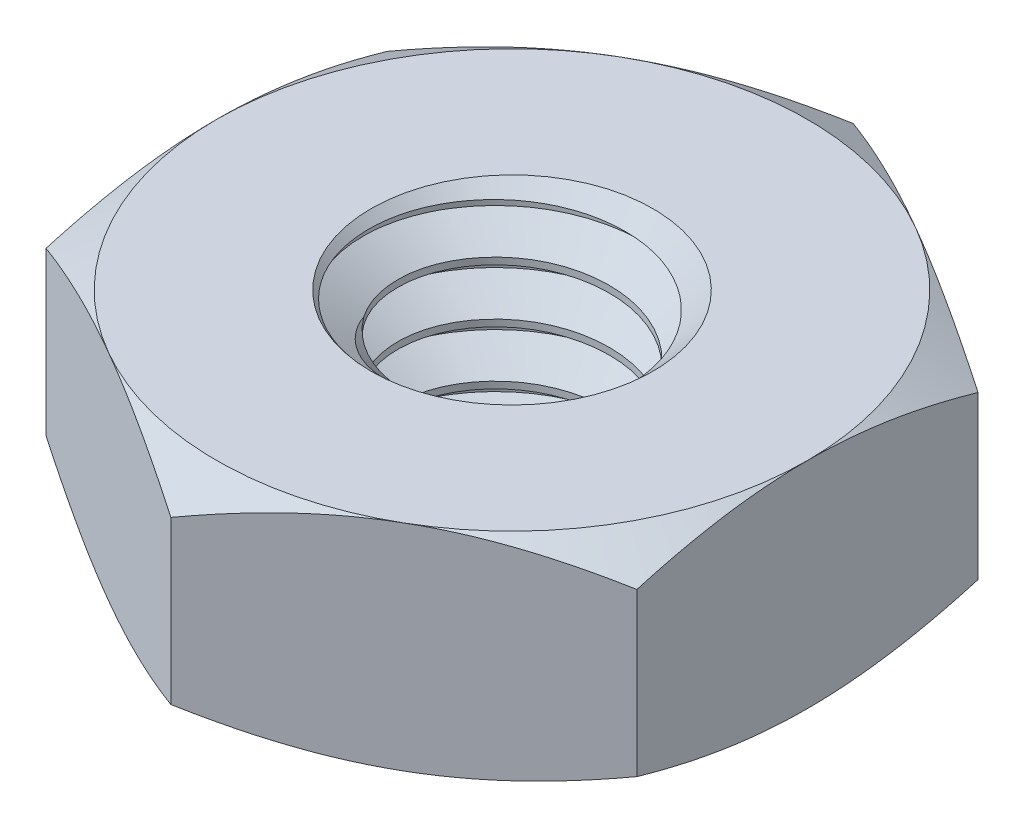
from build123d import *

# Parameters (mm, degrees)
SKETCH11_R              = 2.0828
BOSS_EXTRUDE1_DEPTH     = 1.5875
SKETCH5_OUTSIDE_W       = 42.524
SKETCH5_OUTSIDE_H       = 43.874
SKETCH5_OUTSIDE_R       = 4.365625
CUT_EXTRUDE1_DEPTH      = 8.385856901
CUT_EXTRUDE1_DRAFT      = -60
MIRROR1_COPY_1_SKETCH_W = 42.524
MIRROR1_COPY_1_SKETCH_H = 43.874
MIRROR1_COPY_1_SKETCH_R = 4.365625
MIRROR1_COPY_1_DEPTH    = 8.385856901
MIRROR1_COPY_1_DRAFT    = -60
SKETCH23_R              = 2.0828
BOSS_EXTRUDE2_DEPTH     = 3.175
BOSS_EXTRUDE3_START     = -3.175
SKETCH24_R              = 2.0828
BOSS_EXTRUDE3_DEPTH     = 3.175
CUT_SWEEP1_PITCH        = 0.79375


with BuildPart() as part:
    # Sketch11 → Boss-Extrude1 (new, symmetric)
    with BuildSketch(Plane(origin=(0, 0, 0), x_dir=(1, 0, 0), z_dir=(0, 1, 0))):
        Polygon((-4.365625, 2.520494769), (-4.365625, -2.520494769), (0, -5.040989538), (4.365625, -2.520494769), (4.365625, 2.520494769), (0, 5.040989538), align=None)
        with Locations(Location((0, 0, 0), (0, 0, 270))):
            Circle(SKETCH11_R, mode=Mode.SUBTRACT)
    extrude(amount=BOSS_EXTRUDE1_DEPTH, both=True)


with BuildPart() as cut_extrude1_tool:
    # Sketch5 outside → Cut-Extrude1 (with draft: the straight prism first)
    with BuildSketch(Plane(origin=(0, 1.5875, 0), x_dir=(1, 0, 0), z_dir=(0, 1, 0))):
        Rectangle(SKETCH5_OUTSIDE_W, SKETCH5_OUTSIDE_H)
        Circle(SKETCH5_OUTSIDE_R, mode=Mode.SUBTRACT)
    extrude(amount=-CUT_EXTRUDE1_DEPTH)
    # Cut-Extrude1: the draft: its side faces are tilted about the plane it starts from
    cut_extrude1_sides = [cut_extrude1_tool.faces().sort_by_distance(p)[0] for p in [
        (0, -2.60542845, 21.937),
        (21.262, -2.60542845, 0),
        (0, -2.60542845, -21.937),
        (-21.262, -2.60542845, 0),
        (-4.365625, -2.60542845, 0),
    ]]
    draft(cut_extrude1_sides, Plane(origin=(0, 1.5875, 0), x_dir=(1, 0, 0), z_dir=(0, 1, 0)), CUT_EXTRUDE1_DRAFT)


with BuildPart() as part_1:
    add(part.part)

    # Cut-Extrude1: cut by cut_extrude1_tool
    add(cut_extrude1_tool.part, mode=Mode.SUBTRACT)


with BuildPart() as mirror1_copy_1_tool:
    # Mirror1 copy 1 sketch → Mirror1 copy 1 (with draft: the straight prism first)
    with BuildSketch(Plane.XZ.offset(1.5875)):
        Rectangle(MIRROR1_COPY_1_SKETCH_W, MIRROR1_COPY_1_SKETCH_H)
        Circle(MIRROR1_COPY_1_SKETCH_R, mode=Mode.SUBTRACT)
    extrude(amount=-MIRROR1_COPY_1_DEPTH)
    # Mirror1 copy 1: the draft: its side faces are tilted about the plane it starts from
    mirror1_copy_1_sides = [mirror1_copy_1_tool.faces().sort_by_distance(p)[0] for p in [
        (0, 2.60542845, 21.937),
        (21.262, 2.60542845, 0),
        (0, 2.60542845, -21.937),
        (-21.262, 2.60542845, 0),
        (-4.365625, 2.60542845, 0),
    ]]
    draft(mirror1_copy_1_sides, Plane.XZ.offset(1.5875), MIRROR1_COPY_1_DRAFT)


with BuildPart() as part_2:
    add(part_1.part)

    # Mirror1 copy 1: cut by mirror1_copy_1_tool
    add(mirror1_copy_1_tool.part, mode=Mode.SUBTRACT)

    # Sketch24 → Boss-Extrude3 (add)
    with BuildSketch(Plane(origin=(0, 1.5875, 0), x_dir=(1, 0, 0), z_dir=(0, 1, 0)).offset(BOSS_EXTRUDE3_START)):
        with Locations(Location((0, 0, 0), (0, 0, 270))):
            Circle(SKETCH24_R)
    extrude(amount=BOSS_EXTRUDE3_DEPTH)


with BuildPart() as body_2:
    # Sketch23 → Boss-Extrude2 (new body)
    with BuildSketch(Plane(origin=(0, 1.5875, 0), x_dir=(1, 0, 0), z_dir=(0, 1, 0))):
        with Locations(Location((0, 0, 0), (0, 0, 270))):
            Circle(SKETCH23_R)
    extrude(amount=-BOSS_EXTRUDE2_DEPTH)

    # Cut-Sweep1: the profile of Sketch25 profile screwed along a right-hand helix of 5 turns, 8 arcs to a turn; built about Z, then put on its axis
    cut_sweep1_z = Axis((0, 0, 0), (0, 0, 1))
    cut_sweep1_corners = [(2.0831, 0, 0.000173205), (2.0831, 0, -0.694704455), (1.567244252, 0, -0.396875), (1.567244252, 0, -0.29765625)]
    with BuildLine(mode=Mode.PRIVATE) as cut_sweep1_profile:
        Line(cut_sweep1_corners[0], cut_sweep1_corners[1])
        Line(cut_sweep1_corners[1], cut_sweep1_corners[2])
        Line(cut_sweep1_corners[2], cut_sweep1_corners[3])
        Line(cut_sweep1_corners[3], cut_sweep1_corners[0])
    cut_sweep1_cap = Face(cut_sweep1_profile.wire())
    cut_sweep1_turn_angles = [0, 22.5, 45, 67.5, 90, 112.5, 135, 157.5, 180, 202.5, 225, 247.5, 270, 292.5, 315, 337.5, 360]
    cut_sweep1_turn_weights = [1, 0.9238795325112867, 1, 0.9238795325112867, 1, 0.9238795325112867, 1, 0.9238795325112867, 1, 0.9238795325112867, 1, 0.9238795325112867, 1, 0.9238795325112867, 1, 0.9238795325112867, 1]
    cut_sweep1_turn_rails = [Edge.make_bspline([Vector(p[0], p[1], 0).rotate(cut_sweep1_z, cut_sweep1_turn_angles[k]) / cut_sweep1_turn_weights[k] + Vector(0, 0, p[2] + CUT_SWEEP1_PITCH * cut_sweep1_turn_angles[k] / 360) for k in range(17)], [0, 0, 0, 1, 1, 2, 2, 3, 3, 4, 4, 5, 5, 6, 6, 7, 7, 8, 8, 8], 2, cut_sweep1_turn_weights) for p in cut_sweep1_corners]
    cut_sweep1_turn_sides = [Face.make_surface_from_curves(cut_sweep1_turn_rails[p[0]], cut_sweep1_turn_rails[p[1]]) for p in [(0, 1), (1, 2), (2, 3), (3, 0)]]
    cut_sweep1 = Plane(origin=(0, 1.5875, 0), x_dir=(0, 0, 1), z_dir=(0, -1, 0)) * Solid(Shell([*[p.moved(Location((0, 0, CUT_SWEEP1_PITCH * i))) for i in range(5) for p in cut_sweep1_turn_sides], cut_sweep1_cap, cut_sweep1_cap.rotate(cut_sweep1_z, 1800).moved(Location((0, 0, CUT_SWEEP1_PITCH * 1800 / 360)))]))
    add(cut_sweep1, mode=Mode.SUBTRACT)


with BuildPart() as part_3:
    add(part_2.part)

    # Combine1: cut body 2
    add(body_2.part, mode=Mode.SUBTRACT)

    # Cut-Extrude2 cone 1 section (through the dimple's axis) → Cut-Extrude2 (revolve, cut)
    with BuildSketch(Plane(origin=(0, 1.5875, 0), x_dir=(0, 0, 1), z_dir=(1, 0, 0))):
        Polygon((0, 0), (2.0828, 0), (0, 2.0828), align=None)
    cut_extrude2 = revolve(axis=Axis((0, 1.5875, 0), (0, -1, 0)), mode=Mode.SUBTRACT)

    # Mirror2: Cut-Extrude2 across plane
    add(cut_extrude2.mirror(Plane.ZX), mode=Mode.SUBTRACT)


solid = part_3.part
